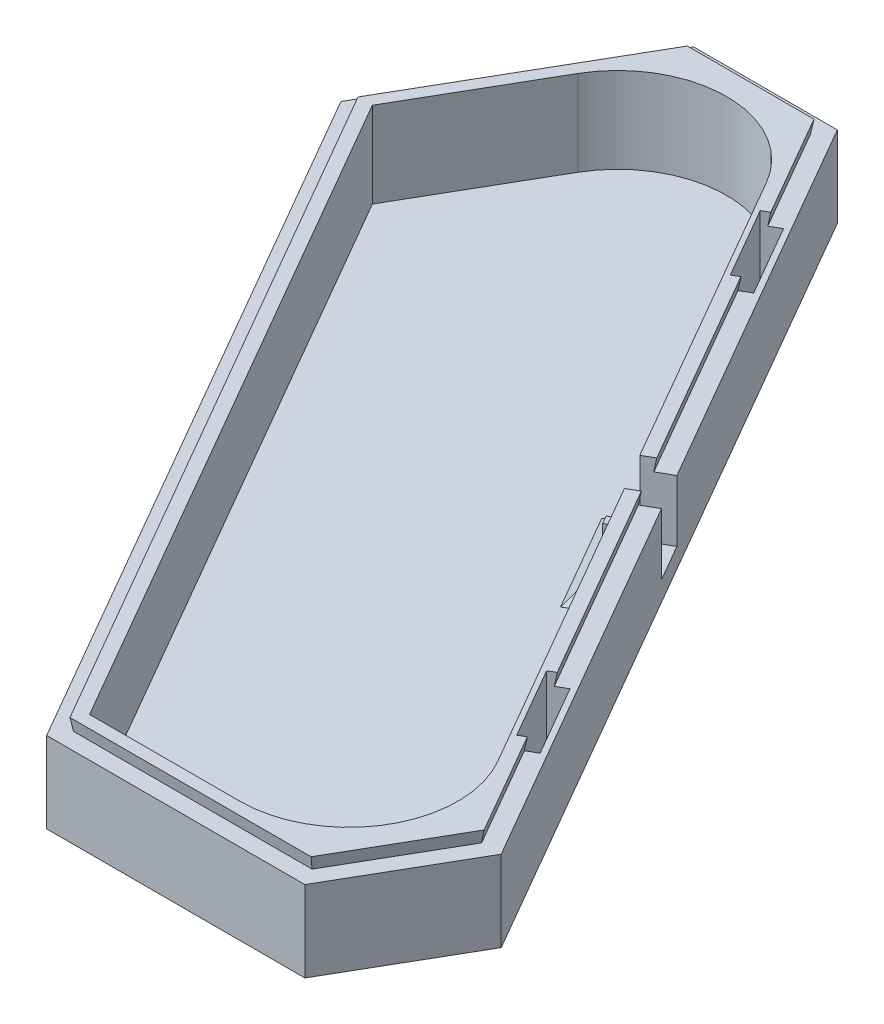
from build123d import *

# Parameters (mm, degrees)
BOSS_EXTRU_1_DEPTH              = 12
ENL_V_MAT_EXTRU_1_DEPTH         = 119.989845505
ENL_V_MAT_EXTRU_2_DEPTH         = 11
ENL_V_MAT_EXTRU_3_DEPTH         = 9.5
BOSS_EXTRU_6_DEPTH              = 2.2
BOSS_EXTRU_8_DEPTH              = 1.5
BOSS_EXTRU_7_DEPTH              = 3
BOSS_EXTRU_7_DIRECTION_2_REACH  = 102.687
CHANFREIN3_SIZE                 = 2.2
ENL_V_DE_MAT_EXTRU_MINCE1_DEPTH = 1.6
ENL_V_DE_MAT_EXTRU_MINCE1_DRAFT = 10
ENL_V_MAT_EXTRU_10_DEPTH        = 11


with BuildPart() as part:
    # Esquisse1 → Boss.-Extru.1 (new body)
    with BuildSketch(Plane(origin=(0, 0, 0), x_dir=(1, 0, 0), z_dir=(0, 1, 0))):
        Polygon((-77.5, -44.744645862), (77.5, -44.744645862), (0, 89.489291724), align=None)
    extrude(amount=BOSS_EXTRU_1_DEPTH)

    # Esquisse2 → Enlèv. mat.-Extru.1 (cut, through all)
    with BuildSketch(Plane(origin=(0, 12, 0), x_dir=(1, 0, 0), z_dir=(0, 1, 0))):
        Polygon((-9.237604307, 73.489291724), (9.237604307, 73.489291724), (0, 89.489291724), align=None)
        Polygon((77.5, -44.744645862), (68.262395693, -28.744645862), (59.024791386, -44.744645862), align=None)
        Polygon((-77.5, -44.744645862), (25.833333333, -44.744645862), (-25.833333333, 44.744645862), align=None)
    extrude(amount=-ENL_V_MAT_EXTRU_1_DEPTH, mode=Mode.SUBTRACT)

    # Esquisse3 → Enlèv. mat.-Extru.2 (cut)
    with BuildSketch(Plane(origin=(0, 12, 0), x_dir=(1, 0, 0), z_dir=(0, 1, 0))):
        with BuildLine():
            Line((59.313466521, -20.244645862), (12.124355653, 61.489291724))
            ThreePointArc((12.124355653, 61.489291724), (0, 68.489291724), (-12.124355653, 61.489291724))
            Line((-12.124355653, 61.489291724), (-21.791881449, 44.744645862))
            Line((-21.791881449, 44.744645862), (27.854059275, -41.244645862))
            Line((27.854059275, -41.244645862), (47.189110868, -41.244645862))
            ThreePointArc((47.189110868, -41.244645862), (59.313466521, -34.244645862), (59.313466521, -20.244645862))
        make_face()
    extrude(amount=-ENL_V_MAT_EXTRU_2_DEPTH, mode=Mode.SUBTRACT)

    # Esquisse4 → Enlèv. mat.-Extru.3 (cut)
    with BuildSketch(Plane(origin=(0, 12, 0), x_dir=(1, 0, 0), z_dir=(0, 1, 0))):
        Polygon((37.068911087, 18.284054341), (34.368911087, 22.960591521), (37.4, 24.710591521), (40.1, 20.034054341), align=None)
    extrude(amount=-ENL_V_MAT_EXTRU_3_DEPTH, mode=Mode.SUBTRACT)

    # Esquisse14 → Boss.-Extru.6 (add)
    with BuildSketch(Plane(origin=(0, 1, 0), x_dir=(1, 0, 0), z_dir=(0, 1, 0))):
        Polygon((32.699295844, 24.65244995), (37.699295844, 15.992195912), (35.967245037, 14.992195912), (30.967245037, 23.65244995), align=None)
    extrude(amount=BOSS_EXTRU_6_DEPTH)

    # Esquisse19 → Boss.-Extru.8 (add)
    with BuildSketch(Plane(origin=(0, 2.5, 0), x_dir=(1, 0, 0), z_dir=(0, 1, 0))):
        Polygon((34.368911087, 22.960591521), (37.068911087, 18.284054341), (36.549295844, 17.984054341), (33.849295844, 22.660591521), align=None)
    extrude(amount=-BOSS_EXTRU_8_DEPTH)

    # Esquisse15 → Boss.-Extru.7 (add)
    with BuildSketch(Plane(origin=(0, 3.2, 0), x_dir=(1, 0, 0), z_dir=(0, 1, 0))):
        Polygon((35.159103466, 20.991938173), (35.759103466, 19.952707689), (33.767245037, 18.802707689), (33.167245037, 19.841938173), align=None)
    extrude(amount=BOSS_EXTRU_7_DEPTH)

    # Boss.-Extru.7 direction 2: up to this face of the body (flat: up to its plane)
    boss_extru_7_direction_2_end = Plane(part.part.faces().sort_by_distance((19.594473703, 1, -11.312874667))[0])
    # Esquisse15 → Boss.-Extru.7 direction 2 (add, up to the picked face)
    with BuildSketch(Plane(origin=(0, 3.2, 0), x_dir=(1, 0, 0), z_dir=(0, 1, 0)), mode=Mode.PRIVATE) as boss_extru_7_direction_2_sk1:
        Polygon((35.159103466, 20.991938173), (35.759103466, 19.952707689), (33.767245037, 18.802707689), (33.167245037, 19.841938173), align=None)
    boss_extru_7_direction_2_tool1 = split(extrude(boss_extru_7_direction_2_sk1.sketch, amount=-BOSS_EXTRU_7_DIRECTION_2_REACH, mode=Mode.PRIVATE), bisect_by=boss_extru_7_direction_2_end, keep=Keep.BOTH, mode=Mode.PRIVATE)
    add(boss_extru_7_direction_2_tool1.solids().sort_by(Axis((34.463174, 3.2, -19.897323), (0, -1, 0)))[0])

    # Chanfrein3
    chanfrein3_edges = [part.edges().sort_by_distance(p)[0] for p in [
        (33.467245037, 1, -19.322322931),
        (36.833270441, 1, -15.492195912),
        (31.833270441, 1, -24.15244995),
    ]]
    chamfer(chanfrein3_edges, length=CHANFREIN3_SIZE - 0.0001)  # a hair under: the kernel refuses the full size


with BuildPart() as enl_v_de_mat_extru_mince1_tool:
    # Esquisse17 → Enlèv. de mat.-Extru.-Mince1 (with draft: the straight prism first)
    with BuildSketch(Plane(origin=(0, 12, 0), x_dir=(1, 0, 0), z_dir=(0, 1, 0))):
        Polygon((37.4, 24.710591521), (9.237604307, 73.489291724), (-9.237604307, 73.489291724), (-25.833333333, 44.744645862), (25.833333333, -44.744645862), (59.024791386, -44.744645862), (68.262395693, -28.744645862), (40.1, 20.034054341), (38.454551733, 19.084054341), (66.06846467, -28.744645862), (57.927825874, -42.844645862), (26.930298845, -42.844645862), (-23.63940231, 44.744645862), (-8.140638796, 71.589291724), (8.140638796, 71.589291724), (35.754551733, 23.760591521), align=None)
    extrude(amount=-ENL_V_DE_MAT_EXTRU_MINCE1_DEPTH)
    # Enlèv. de mat.-Extru.-Mince1: the draft: its side faces are tilted about the plane it starts from
    enl_v_de_mat_extru_mince1_sides = [enl_v_de_mat_extru_mince1_tool.faces().sort_by_distance(p)[0] for p in [
        (23.318802154, 11.2, -49.099941623),
        (0, 11.2, -73.489291724),
        (-17.53546882, 11.2, -59.116968793),
        (0, 11.2, 0),
        (42.42906236, 11.2, 44.744645862),
        (63.643593539, 11.2, 36.744645862),
        (54.181197846, 11.2, 4.355295761),
        (39.277275866, 11.2, -19.559054341),
        (52.261508201, 11.2, 4.830295761),
        (61.998145272, 11.2, 35.794645862),
        (42.42906236, 11.2, 42.844645862),
        (1.645448267, 11.2, -0.95),
        (-15.890020553, 11.2, -58.166968793),
        (0, 11.2, -71.589291724),
        (21.947595264, 11.2, -47.674941623),
        (36.577275866, 11.2, -24.235591521),
    ]]
    draft(enl_v_de_mat_extru_mince1_sides, Plane(origin=(0, 12, 0), x_dir=(1, 0, 0), z_dir=(0, 1, 0)), ENL_V_DE_MAT_EXTRU_MINCE1_DRAFT)


with BuildPart() as part_1:
    add(part.part)

    # Enlèv. de mat.-Extru.-Mince1: cut by enl_v_de_mat_extru_mince1_tool
    add(enl_v_de_mat_extru_mince1_tool.part, mode=Mode.SUBTRACT)

    # Esquisse18 → Enlèv. mat.-Extru.10 (cut)
    with BuildSketch(Plane(origin=(0, 12, 0), x_dir=(1, 0, 0), z_dir=(0, 1, 0))):
        Polygon((57.613526329, -16.100263081), (59.518782217, -15.000263081), (54.268782217, -5.906996341), (52.363526329, -7.006996341), align=None)
        Polygon((20.113526329, 48.851642203), (14.863526329, 57.944908943), (16.768782217, 59.044908943), (22.018782217, 49.951642203), align=None)
    extrude(amount=-ENL_V_MAT_EXTRU_10_DEPTH, mode=Mode.SUBTRACT)


solid = part_1.part
